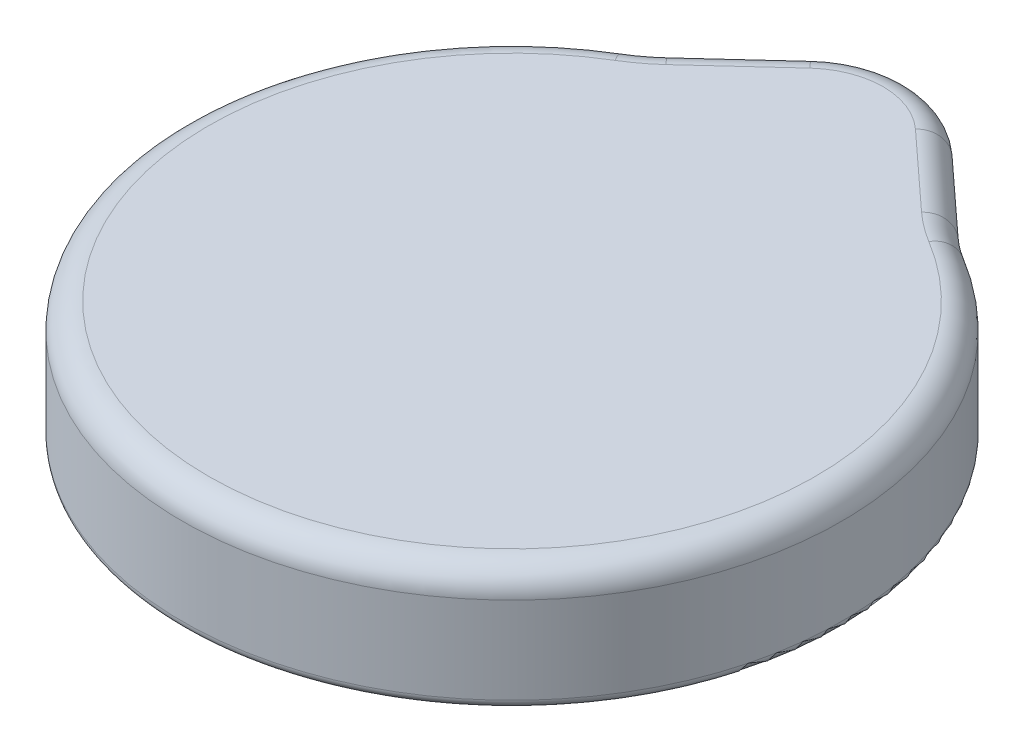
from build123d import *

# Parameters (mm, degrees)
BOSS_EXTRUDE1_DEPTH = 10
BOSS_EXTRUDE2_START = 4
BOSS_EXTRUDE2_DEPTH = 4
FILLET1_R           = 1
FILLET2_R           = 3
FILLET3_R           = 1


with BuildPart() as part:
    # Sketch2 → Boss-Extrude1 (new body)
    with BuildSketch(Plane(origin=(0, 0, 0), x_dir=(1, 0, 0), z_dir=(0, 1, 0))):
        with BuildLine():
            Line((8.117655452, 42.627745196), (16.764304352, 34.685510469))
            ThreePointArc((16.764304352, 34.685510469), (18.147506186, 33.536916036), (19.638391538, 32.53203925))
            ThreePointArc((19.638391538, 32.53203925), (0, -38), (-19.638391538, 32.53203925))
            ThreePointArc((-19.638391538, 32.53203925), (-18.147506186, 33.536916036), (-16.764304352, 34.685510469))
            Line((-16.764304352, 34.685510469), (-8.117655452, 42.627745196))
            ThreePointArc((-8.117655452, 42.627745196), (0, 45.790117123), (8.117655452, 42.627745196))
        make_face()
        with BuildLine():
            Line((-6.764712877, 41.154807184), (-15.411361777, 33.212572457))
            ThreePointArc((-15.411361777, 33.212572457), (-16.948252704, 31.93635642), (-18.604791984, 30.819826658))
            ThreePointArc((-18.604791984, 30.819826658), (0, -36), (18.604791984, 30.819826658))
            ThreePointArc((18.604791984, 30.819826658), (16.948252704, 31.93635642), (15.411361777, 33.212572457))
            Line((15.411361777, 33.212572457), (6.764712877, 41.154807184))
            ThreePointArc((6.764712877, 41.154807184), (0, 43.790117123), (-6.764712877, 41.154807184))
        make_face(mode=Mode.SUBTRACT)
    extrude(amount=-BOSS_EXTRUDE1_DEPTH)

    # Sketch2<2> → Boss-Extrude2 (add)
    with BuildSketch(Plane(origin=(0, 0, 0), x_dir=(1, 0, 0), z_dir=(0, 1, 0)).offset(BOSS_EXTRUDE2_START)):
        with BuildLine():
            Line((8.117655452, 42.627745196), (16.764304352, 34.685510469))
            ThreePointArc((16.764304352, 34.685510469), (18.147506186, 33.536916036), (19.638391538, 32.53203925))
            ThreePointArc((19.638391538, 32.53203925), (0, -38), (-19.638391538, 32.53203925))
            ThreePointArc((-19.638391538, 32.53203925), (-18.147506186, 33.536916036), (-16.764304352, 34.685510469))
            Line((-16.764304352, 34.685510469), (-8.117655452, 42.627745196))
            ThreePointArc((-8.117655452, 42.627745196), (0, 45.790117123), (8.117655452, 42.627745196))
        make_face()
    extrude(amount=-BOSS_EXTRUDE2_DEPTH)

    # Fillet1
    fillet1_edges = [part.edges().sort_by_distance(p)[0] for p in [
        (16.948252704, 0, -31.93635642),
        (11.088037327, 0, -37.183689821),
        (0, 0, -43.790117123),
        (-11.088037327, 0, -37.183689821),
        (-16.948252704, 0, -31.93635642),
        (0, 0, 36),
    ]]
    fillet(fillet1_edges, radius=FILLET1_R)

    # Fillet2
    fillet2_edges = [part.edges().sort_by_distance(p)[0] for p in [
        (-18.147506186, 4, -33.536916036),
        (12.440979902, 4, -38.656627833),
        (0, 4, -45.790117123),
        (0, 4, 38),
        (18.147506186, 4, -33.536916036),
        (-12.440979902, 4, -38.656627833),
    ]]
    fillet(fillet2_edges, radius=FILLET2_R)

    # Fillet3
    fillet3_edges = [part.edges().sort_by_distance(p)[0] for p in [
        (18.147506186, -10, -33.536916036),
        (12.440979902, -10, -38.656627833),
        (0, -10, -45.790117123),
        (16.948252704, -10, -31.93635642),
        (0, -10, 36),
        (-16.948252704, -10, -31.93635642),
        (-11.088037327, -10, -37.183689821),
        (0, -10, -43.790117123),
        (11.088037327, -10, -37.183689821),
        (-12.440979902, -10, -38.656627833),
        (-18.147506186, -10, -33.536916036),
        (0, -10, 38),
    ]]
    fillet(fillet3_edges, radius=FILLET3_R - 0.0001)  # a hair under: the kernel refuses the full size


solid = part.part
